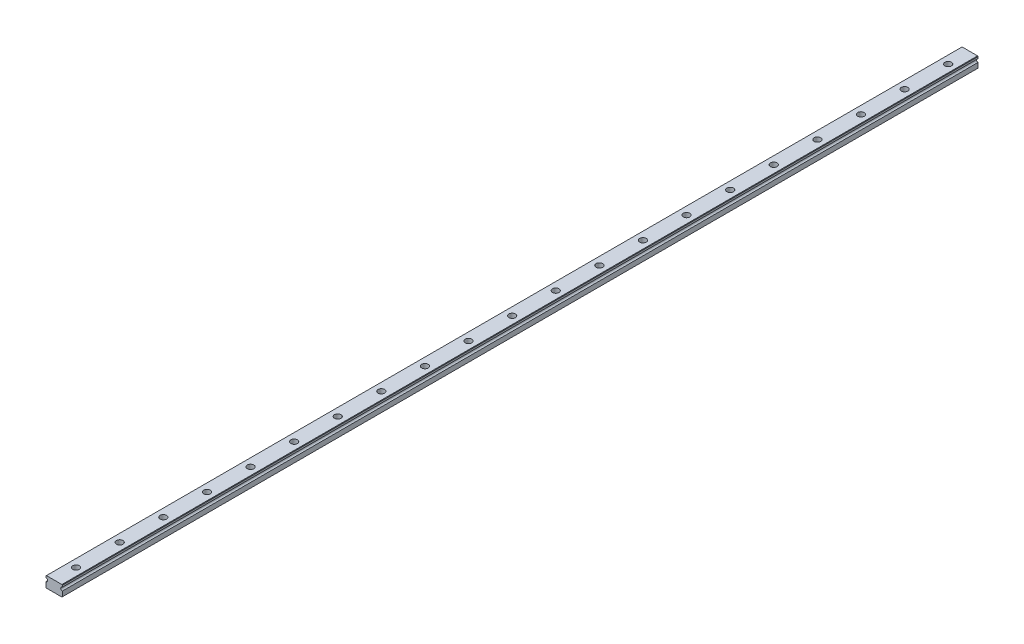
from build123d import *

# Parameters (mm, degrees)
EXTRUDE_1_DEPTH        = 1000
SKETCH_2_R             = 1.5
CUT_EXTRUDE_1_DEPTH    = 20
SKETCH_3_R             = 3
CUT_EXTRUDE_2_DEPTH    = 4.5
PATTERN_LINEAR_1_COUNT = 25
PATTERN_LINEAR_1_PITCH = 40
CUT_EXTRUDE_4_DEPTH    = 80
CUT_EXTRUDE_5_DEPTH    = 80


with BuildPart() as part:
    # 草图1 → 凸台-拉伸1 (new body)
    with BuildSketch(Plane.XY):
        with BuildLine():
            Line((-7.643186957, 0.234233912), (-7.643186957, -4.365766088))
            Line((-7.643186957, -4.365766088), (-7.243186957, -4.765766088))
            Line((-7.243186957, -4.765766088), (6.956813043, -4.765766088))
            Line((6.956813043, -4.765766088), (7.356813043, -4.365766088))
            Line((7.356813043, -4.365766088), (7.356813043, 0.234233912))
            ThreePointArc((7.356813043, 0.234233912), (6.296152871, 0.67357374), (5.856813043, 1.734233912))
            ThreePointArc((5.856813043, 1.734233912), (6.296152871, 2.794894084), (7.356813043, 3.234233912))
            Line((7.356813043, 3.234233912), (7.356813043, 4.834233912))
            Line((7.356813043, 4.834233912), (6.956813043, 5.234233912))
            Line((6.956813043, 5.234233912), (-7.243186957, 5.234233912))
            Line((-7.243186957, 5.234233912), (-7.643186957, 4.834233912))
            Line((-7.643186957, 4.834233912), (-7.643186957, 3.234233912))
            ThreePointArc((-7.643186957, 3.234233912), (-6.143186957, 1.734233912), (-7.643186957, 0.234233912))
        make_face()
    extrude(amount=EXTRUDE_1_DEPTH)

    # 草图2 → 切除-拉伸1 (cut)
    with BuildSketch(Plane(origin=(0, 5.234233912, 0), x_dir=(1, 0, 0), z_dir=(0, 1, 0))):
        with Locations((0, -20)):
            Circle(SKETCH_2_R)
    cut_extrude_1 = extrude(amount=-CUT_EXTRUDE_1_DEPTH, mode=Mode.SUBTRACT)

    # 草图3 → 切除-拉伸2 (cut)
    with BuildSketch(Plane(origin=(0, 5.234233912, 0), x_dir=(1, 0, 0), z_dir=(0, 1, 0))):
        with Locations((0, -20)):
            Circle(SKETCH_3_R)
    cut_extrude_2 = extrude(amount=-CUT_EXTRUDE_2_DEPTH, mode=Mode.SUBTRACT)

    # 阵列(线性)1: 切除-拉伸1, 切除-拉伸2 ×25
    with Locations(*[(0, 0, i * PATTERN_LINEAR_1_PITCH) for i in range(1, PATTERN_LINEAR_1_COUNT)]):
        add(cut_extrude_1, mode=Mode.SUBTRACT)
        add(cut_extrude_2, mode=Mode.SUBTRACT)

    # 草图6 → 切除-拉伸4 (cut)
    with BuildSketch(Plane(origin=(0, 0, 0), x_dir=(-1, 0, 0), z_dir=(0, 0, -1))):
        with BuildLine():
            Line((7.643186957, 3.234233912), (7.643186957, 4.834233912))
            Line((7.643186957, 4.834233912), (7.243186957, 5.234233912))
            Line((7.243186957, 5.234233912), (-6.956813043, 5.234233912))
            Line((-6.956813043, 5.234233912), (-7.356813043, 4.834233912))
            Line((-7.356813043, 4.834233912), (-7.356813043, 3.234233912))
            ThreePointArc((-7.356813043, 3.234233912), (-5.856813043, 1.734233912), (-7.356813043, 0.234233912))
            Line((-7.356813043, 0.234233912), (-7.356813043, -4.365766088))
            Line((-7.356813043, -4.365766088), (-6.956813043, -4.765766088))
            Line((-6.956813043, -4.765766088), (7.243186957, -4.765766088))
            Line((7.243186957, -4.765766088), (7.643186957, -4.365766088))
            Line((7.643186957, -4.365766088), (7.643186957, 0.234233912))
            ThreePointArc((7.643186957, 0.234233912), (6.143186957, 1.734233912), (7.643186957, 3.234233912))
        make_face()
    extrude(amount=-CUT_EXTRUDE_4_DEPTH, mode=Mode.SUBTRACT)

    # 草图7 → 切除-拉伸5 (cut)
    with BuildSketch(Plane(origin=(0, 0, 80), x_dir=(-1, 0, 0), z_dir=(0, 0, -1))):
        with BuildLine():
            Line((7.643186957, 3.234233912), (7.643186957, 4.834233912))
            Line((7.643186957, 4.834233912), (7.243186957, 5.234233912))
            Line((7.243186957, 5.234233912), (-6.956813043, 5.234233912))
            Line((-6.956813043, 5.234233912), (-7.356813043, 4.834233912))
            Line((-7.356813043, 4.834233912), (-7.356813043, 3.234233912))
            ThreePointArc((-7.356813043, 3.234233912), (-5.856813043, 1.734233912), (-7.356813043, 0.234233912))
            Line((-7.356813043, 0.234233912), (-7.356813043, -4.365766088))
            Line((-7.356813043, -4.365766088), (-6.956813043, -4.765766088))
            Line((-6.956813043, -4.765766088), (7.243186957, -4.765766088))
            Line((7.243186957, -4.765766088), (7.643186957, -4.365766088))
            Line((7.643186957, -4.365766088), (7.643186957, 0.234233912))
            ThreePointArc((7.643186957, 0.234233912), (6.143186957, 1.734233912), (7.643186957, 3.234233912))
        make_face()
    extrude(amount=-CUT_EXTRUDE_5_DEPTH, mode=Mode.SUBTRACT)


solid = part.part
